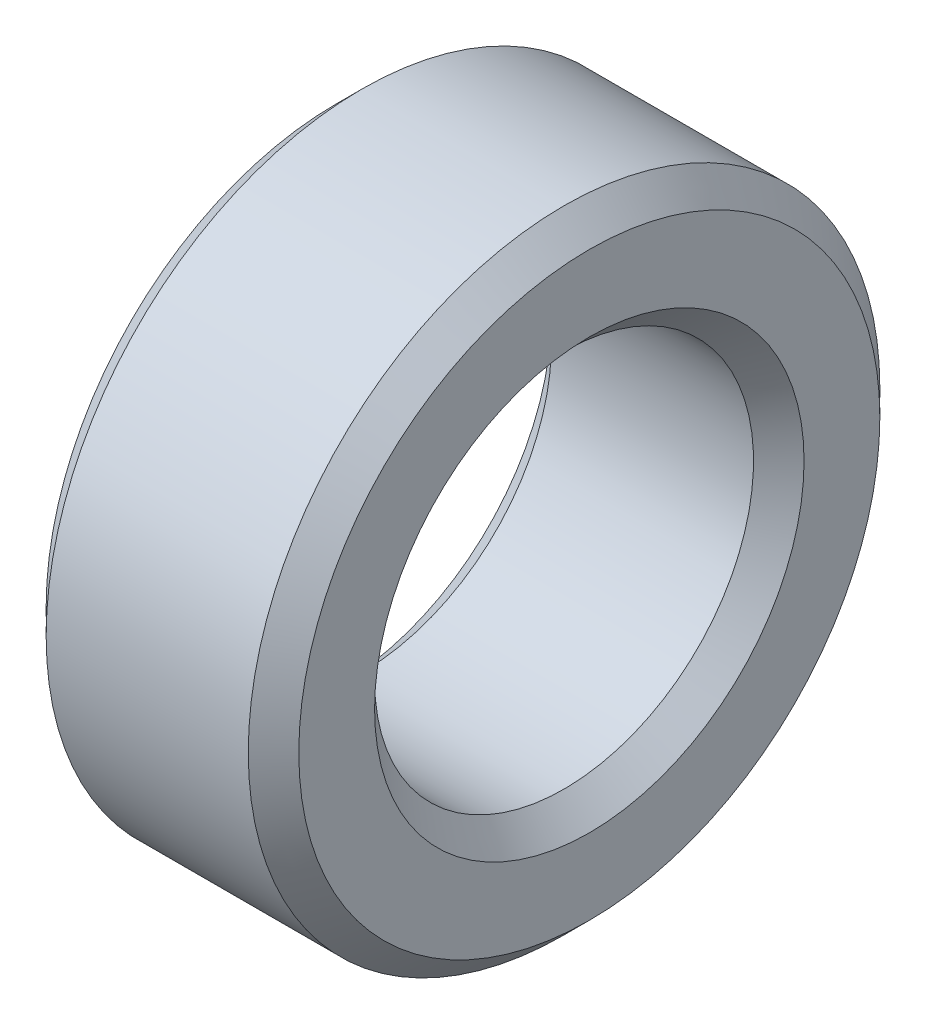
from build123d import *

# Parameters (mm, degrees)
SKETCH1_W     = 2
SKETCH1_H     = 1
CHAMFER1_SIZE = 0.2


with BuildPart() as part:
    # Sketch1 → Revolve1 (revolve)
    with BuildSketch(Plane.XY):
        with Locations((1, 2)):
            Rectangle(SKETCH1_W, SKETCH1_H)
    revolve(axis=Axis((0, 0, 0), (1, 0, 0)))

    # Chamfer1
    chamfer1_edges = [part.edges().sort_by_distance(p)[0] for p in [
        (0, -2.5, 0),
        (2, -2.5, 0),
        (2, -1.5, 0),
        (0, -1.5, 0),
    ]]
    chamfer(chamfer1_edges, length=CHAMFER1_SIZE)


solid = part.part
